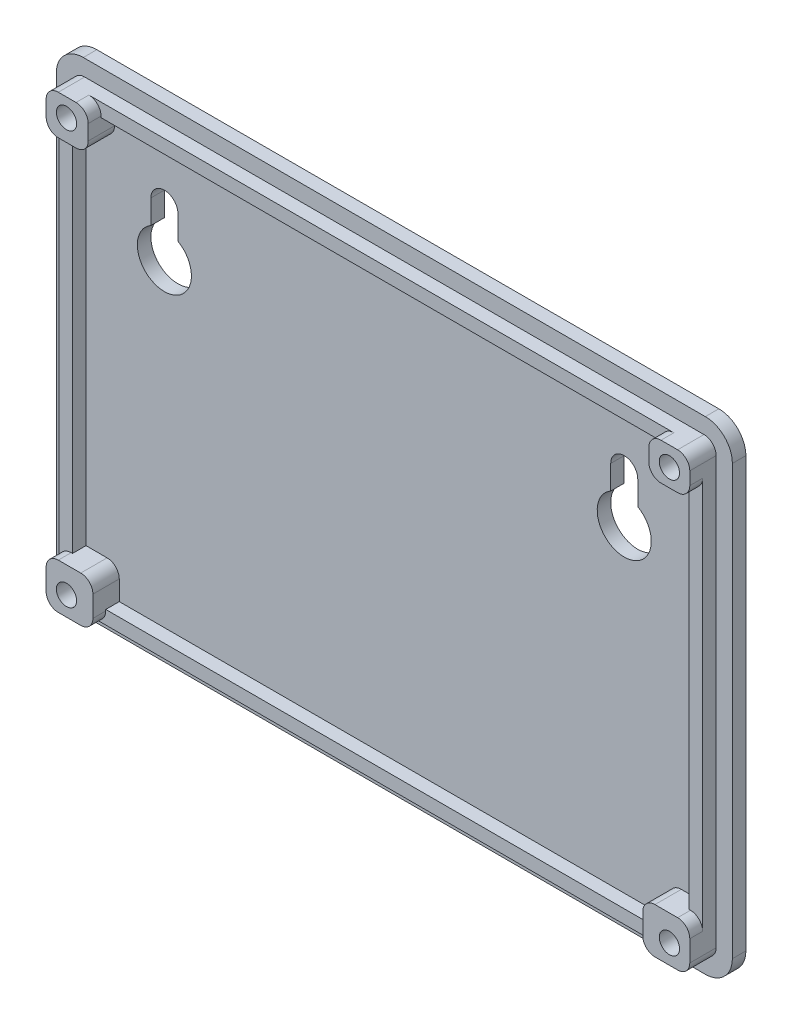
from build123d import *

# Parameters (mm, degrees)
SKETCH_2_R      = 1.5
EXTRUDE_1_DEPTH = 2
SKETCH_4_R      = 1.5
EXTRUDE_2_DEPTH = 2
SKETCH_5_R      = 1.5
EXTRUDE_3_DEPTH = 1.9
CHAMFER_1_SIZE  = 1


with BuildPart() as part:
    # Эскиз2 → Бобышка-Вытянуть1 (new body)
    with BuildSketch(Plane.XY):
        with BuildLine():
            Line((-50.025, 31.7375), (-50.025, -31.7375))
            ThreePointArc((-50.025, -31.7375), (-48.853427125, -34.565927125), (-46.025, -35.7375))
            Line((-46.025, -35.7375), (46.025, -35.7375))
            ThreePointArc((46.025, -35.7375), (48.853427125, -34.565927125), (50.025, -31.7375))
            Line((50.025, -31.7375), (50.025, 31.7375))
            ThreePointArc((50.025, 31.7375), (48.853427125, 34.565927125), (46.025, 35.7375))
            Line((46.025, 35.7375), (-46.025, 35.7375))
            ThreePointArc((-46.025, 35.7375), (-48.853427125, 34.565927125), (-50.025, 31.7375))
        make_face()
        with Locations((-44.608766667, -30.48)):
            Circle(SKETCH_2_R, mode=Mode.SUBTRACT)
        with Locations((44.608733333, -30.48)):
            Circle(SKETCH_2_R, mode=Mode.SUBTRACT)
        with Locations((44.608733333, 30.48)):
            Circle(SKETCH_2_R, mode=Mode.SUBTRACT)
        with Locations((-44.608766667, 30.638733333)):
            Circle(SKETCH_2_R, mode=Mode.SUBTRACT)
        with BuildLine():
            Line((36.025, 22.7375), (36.025, 19.201601615))
            ThreePointArc((36.025, 19.201601615), (34.025, 11.7375), (32.025, 19.201601615))
            Line((32.025, 19.201601615), (32.025, 22.7375))
            ThreePointArc((32.025, 22.7375), (34.025, 24.7375), (36.025, 22.7375))
        make_face(mode=Mode.SUBTRACT)
        with BuildLine():
            Line((-36.025, 19.201601615), (-36.025, 22.7375))
            ThreePointArc((-36.025, 22.7375), (-34.025, 24.7375), (-32.025, 22.7375))
            Line((-32.025, 22.7375), (-32.025, 19.201601615))
            ThreePointArc((-32.025, 19.201601615), (-34.025, 11.7375), (-36.025, 19.201601615))
        make_face(mode=Mode.SUBTRACT)
    extrude(amount=EXTRUDE_1_DEPTH)

    # Эскиз4 → Бобышка-Вытянуть2 (add)
    with BuildSketch(Plane.XY.offset(2)):
        with BuildLine():
            Line((-47.625, 31.5375), (-47.625, 29.297807212))
            Line((-47.625, 29.297807212), (-47.625, -28.425940239))
            Line((-47.625, -28.425940239), (-47.625, -31.5375))
            ThreePointArc((-47.625, -31.5375), (-47.097792206, -32.810292206), (-45.825, -33.3375))
            Line((-45.825, -33.3375), (-42.502359949, -33.3375))
            Line((-42.502359949, -33.3375), (42.469876802, -33.3375))
            Line((42.469876802, -33.3375), (45.825, -33.3375))
            ThreePointArc((45.825, -33.3375), (47.097792206, -32.810292206), (47.625, -31.5375))
            Line((47.625, -31.5375), (47.625, -28.425940239))
            Line((47.625, -28.425940239), (47.625, 29.640861726))
            Line((47.625, 29.640861726), (47.625, 31.5375))
            ThreePointArc((47.625, 31.5375), (47.097792206, 32.810292206), (45.825, 33.3375))
            Line((45.825, 33.3375), (43.367756752, 33.3375))
            Line((43.367756752, 33.3375), (-43.198912783, 33.3375))
            Line((-43.198912783, 33.3375), (-45.825, 33.3375))
            ThreePointArc((-45.825, 33.3375), (-47.097792206, 32.810292206), (-47.625, 31.5375))
        make_face()
        with Locations((-44.608766667, -30.48)):
            Circle(SKETCH_4_R, mode=Mode.SUBTRACT)
        with Locations((44.608733333, -30.48)):
            Circle(SKETCH_4_R, mode=Mode.SUBTRACT)
        with BuildLine():
            Line((-42.502359949, -26.625940239), (-45.625, -26.625940239))
            Line((-45.625, -26.625940239), (-45.625, 27.497807212))
            Line((-45.625, 27.497807212), (-43.198912783, 27.497807212))
            ThreePointArc((-43.198912783, 27.497807212), (-41.926120577, 28.025015005), (-41.398912783, 29.297807212))
            Line((-41.398912783, 29.297807212), (-41.398912783, 31.3375))
            Line((-41.398912783, 31.3375), (41.567756752, 31.3375))
            Line((41.567756752, 31.3375), (41.567756752, 29.640861726))
            ThreePointArc((41.567756752, 29.640861726), (42.094964546, 28.36806952), (43.367756752, 27.840861726))
            Line((43.367756752, 27.840861726), (45.625, 27.840861726))
            Line((45.625, 27.840861726), (45.625, -26.625940239))
            Line((45.625, -26.625940239), (42.469876802, -26.625940239))
            ThreePointArc((42.469876802, -26.625940239), (41.197084596, -27.153148033), (40.669876802, -28.425940239))
            Line((40.669876802, -28.425940239), (40.669876802, -31.3375))
            Line((40.669876802, -31.3375), (-40.702359949, -31.3375))
            Line((-40.702359949, -31.3375), (-40.702359949, -28.425940239))
            ThreePointArc((-40.702359949, -28.425940239), (-41.229567743, -27.153148033), (-42.502359949, -26.625940239))
        make_face(mode=Mode.SUBTRACT)
        with Locations((-44.608766667, 30.638733333)):
            Circle(SKETCH_4_R, mode=Mode.SUBTRACT)
        with Locations((44.608733333, 30.48)):
            Circle(SKETCH_4_R, mode=Mode.SUBTRACT)
    extrude(amount=EXTRUDE_2_DEPTH)

    # Эскиз5 → Бобышка-Вытянуть3 (add)
    # profile 1 of 4: a face of its own
    with BuildSketch(Plane.XY.offset(4)):
        with BuildLine():
            Line((-43.198912783, 33.3375), (-45.825, 33.3375))
            ThreePointArc((-45.825, 33.3375), (-47.097792206, 32.810292206), (-47.625, 31.5375))
            Line((-47.625, 31.5375), (-47.625, 29.297807212))
            ThreePointArc((-47.625, 29.297807212), (-47.097792206, 28.025015005), (-45.825, 27.497807212))
            Line((-45.825, 27.497807212), (-43.198912783, 27.497807212))
            ThreePointArc((-43.198912783, 27.497807212), (-41.926120577, 28.025015005), (-41.398912783, 29.297807212))
            Line((-41.398912783, 29.297807212), (-41.398912783, 31.5375))
            ThreePointArc((-41.398912783, 31.5375), (-41.926120577, 32.810292206), (-43.198912783, 33.3375))
        make_face()
        with Locations((-44.608766667, 30.638733333)):
            Circle(SKETCH_5_R, mode=Mode.SUBTRACT)
    # profile 2 of 4: a face of its own
    with BuildSketch(Plane.XY.offset(4)):
        with BuildLine():
            Line((41.567756752, 31.5375), (41.567756752, 29.640861726))
            ThreePointArc((41.567756752, 29.640861726), (42.094964546, 28.36806952), (43.367756752, 27.840861726))
            Line((43.367756752, 27.840861726), (45.825, 27.840861726))
            ThreePointArc((45.825, 27.840861726), (47.097792206, 28.36806952), (47.625, 29.640861726))
            Line((47.625, 29.640861726), (47.625, 31.5375))
            ThreePointArc((47.625, 31.5375), (47.097792206, 32.810292206), (45.825, 33.3375))
            Line((45.825, 33.3375), (43.367756752, 33.3375))
            ThreePointArc((43.367756752, 33.3375), (42.094964546, 32.810292206), (41.567756752, 31.5375))
        make_face()
        with Locations((44.608733333, 30.48)):
            Circle(SKETCH_5_R, mode=Mode.SUBTRACT)
    # profile 3 of 4: a face of its own
    with BuildSketch(Plane.XY.offset(4)):
        with BuildLine():
            Line((-47.625, -28.425940239), (-47.625, -31.5375))
            ThreePointArc((-47.625, -31.5375), (-47.097792206, -32.810292206), (-45.825, -33.3375))
            Line((-45.825, -33.3375), (-42.502359949, -33.3375))
            ThreePointArc((-42.502359949, -33.3375), (-41.229567743, -32.810292206), (-40.702359949, -31.5375))
            Line((-40.702359949, -31.5375), (-40.702359949, -28.425940239))
            ThreePointArc((-40.702359949, -28.425940239), (-41.229567743, -27.153148033), (-42.502359949, -26.625940239))
            Line((-42.502359949, -26.625940239), (-45.825, -26.625940239))
            ThreePointArc((-45.825, -26.625940239), (-47.097792206, -27.153148033), (-47.625, -28.425940239))
        make_face()
        with Locations((-44.608766667, -30.48)):
            Circle(SKETCH_5_R, mode=Mode.SUBTRACT)
    # profile 4 of 4: a face of its own
    with BuildSketch(Plane.XY.offset(4)):
        with BuildLine():
            Line((40.669876802, -28.425940239), (40.669876802, -31.5375))
            ThreePointArc((40.669876802, -31.5375), (41.197084596, -32.810292206), (42.469876802, -33.3375))
            Line((42.469876802, -33.3375), (45.825, -33.3375))
            ThreePointArc((45.825, -33.3375), (47.097792206, -32.810292206), (47.625, -31.5375))
            Line((47.625, -31.5375), (47.625, -28.425940239))
            ThreePointArc((47.625, -28.425940239), (47.097792206, -27.153148033), (45.825, -26.625940239))
            Line((45.825, -26.625940239), (42.469876802, -26.625940239))
            ThreePointArc((42.469876802, -26.625940239), (41.197084596, -27.153148033), (40.669876802, -28.425940239))
        make_face()
        with Locations((44.608733333, -30.48)):
            Circle(SKETCH_5_R, mode=Mode.SUBTRACT)
    extrude(amount=EXTRUDE_3_DEPTH)

    # Фаска1
    chamfer_1_edges = [part.edges().sort_by_distance(p)[0] for p in [
        (43.108733333, 30.48, 0),
        (43.108733333, -30.48, 0),
        (-46.108766667, -30.48, 0),
        (-46.108766667, 30.638733333, 0),
    ]]
    chamfer(chamfer_1_edges, length=CHAMFER_1_SIZE)


solid = part.part
